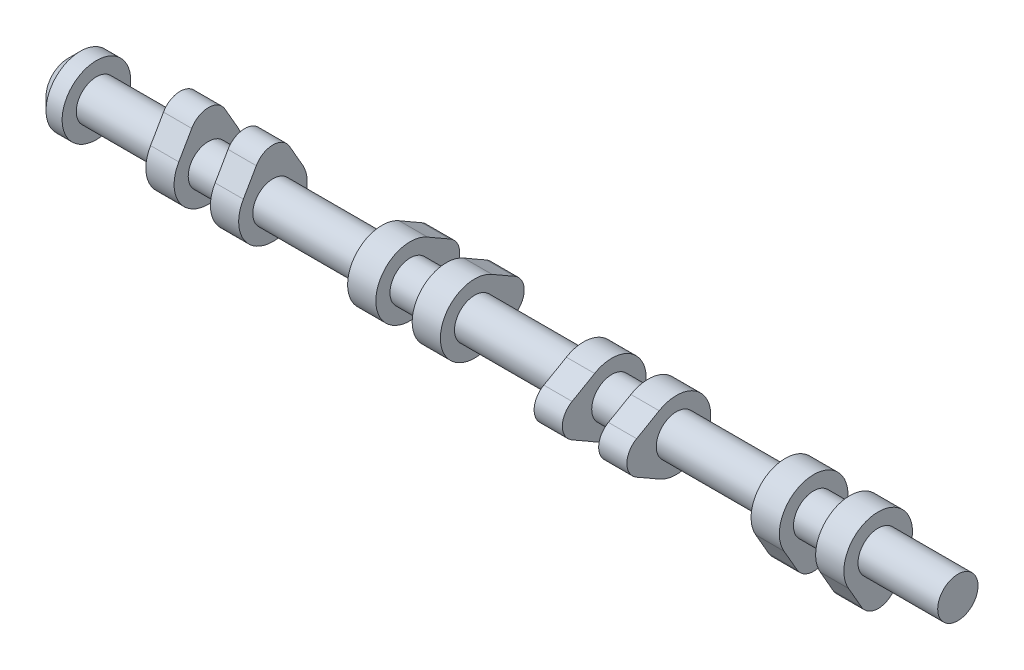
from build123d import *

# Parameters (mm, degrees)
BOSS_EXTRUDE2_DEPTH  = 14
FILLET3_R            = 9.5
FILLET5_R            = 1000
BOSS_EXTRUDE5_DEPTH  = 14
BOSS_EXTRUDE6_DEPTH  = 14
BOSS_EXTRUDE7_DEPTH  = 14
BOSS_EXTRUDE8_DEPTH  = 14
BOSS_EXTRUDE9_DEPTH  = 14
BOSS_EXTRUDE10_DEPTH = 14
BOSS_EXTRUDE11_DEPTH = 14
SKETCH1_6_W          = 16
SKETCH1_6_H          = 7
BOSS_EXTRUDE12_DEPTH = 16
FILLET6_R            = 1000
FILLET7_R            = 4
BOSS_EXTRUDE13_DEPTH = 16
BOSS_EXTRUDE14_DEPTH = 16
BOSS_EXTRUDE15_DEPTH = 16
FRONT_START          = 16
SKETCH22_R           = 17
FRONT_DEPTH          = 16
CHAMFER1_SIZE        = 6
SKETCH23_R           = 6
CUT_EXTRUDE1_DEPTH   = 40
CUT_EXTRUDE2_START   = -2
SKETCH24_R           = 17
SKETCH24_R_2         = 10
CUT_EXTRUDE2_DEPTH   = 2
CUT_EXTRUDE4_DEPTH   = 16
CUT_EXTRUDE5_DEPTH   = 16
CUT_EXTRUDE6_DEPTH   = 16
CUT_EXTRUDE7_DEPTH   = 16
SKETCH33_R           = 10
BOSS_EXTRUDE16_DEPTH = 16
SKETCH32_R           = 10
BOSS_EXTRUDE17_DEPTH = 16
SKETCH31_R           = 10
BOSS_EXTRUDE18_DEPTH = 16
SKETCH30_R           = 10
BOSS_EXTRUDE19_DEPTH = 16


# Some blends are built 0.0001 mm under size
with BuildPart() as part:
    # Sketch1 → Revolve1 (revolve)
    with BuildSketch(Plane.XY, mode=Mode.PRIVATE) as revolve1_sk:
        Polygon((10, 0), (0, 0), (0, -10), (425, -10), (425, 0), (415, 0), (385.5, 0), (378.5, 0), (371.5, 0), (370.5, 0), (354.5, 0), (353.5, 0), (346.5, 0), (339.5, 0), (285.5, 0), (278.5, 0), (271.5, 0), (270.5, 0), (254.5, 0), (253.5, 0), (246.5, 0), (239.5, 0), (185.5, 0), (178.5, 0), (171.5, 0), (170.5, 0), (154.5, 0), (153.5, 0), (146.5, 0), (139.5, 0), (85.5, 0), (78.5, 0), (71.5, 0), (70.5, 0), (54.5, 0), (53.5, 0), (46.5, 0), (39.5, 0), align=None)
    revolve(revolve1_sk.sketch.rotate(Axis((0, -10, 0), (1, 0, 0)), 90), axis=Axis((0, -10, 0), (1, 0, 0)))

    # Sketch1<5> → Revolve2 (revolve)
    with BuildSketch(Plane.XY, mode=Mode.PRIVATE) as revolve2_sk:
        Polygon((39.5, 7), (39.5, 0), (46.5, 0), (53.5, 0), (53.5, 7), align=None)
        Polygon((71.5, 7), (71.5, 0), (78.5, 0), (85.5, 0), (85.5, 7), align=None)
        Polygon((139.5, 7), (139.5, 0), (146.5, 0), (153.5, 0), (153.5, 7), align=None)
        Polygon((171.5, 7), (171.5, 0), (178.5, 0), (185.5, 0), (185.5, 7), align=None)
        Polygon((239.5, 7), (239.5, 0), (246.5, 0), (253.5, 0), (253.5, 7), align=None)
        Polygon((278.5, 0), (285.5, 0), (285.5, 7), (271.5, 7), (271.5, 0), align=None)
        Polygon((346.5, 0), (353.5, 0), (353.5, 7), (339.5, 7), (339.5, 0), align=None)
        Polygon((378.5, 0), (385.5, 0), (385.5, 7), (371.5, 7), (371.5, 0), align=None)
    revolve(revolve2_sk.sketch.rotate(Axis((0, -10, 0), (1, 0, 0)), 90), axis=Axis((0, -10, 0), (1, 0, 0)))

    # Sketch2 → Boss-Extrude2 (add)
    with BuildSketch(Plane.ZY.offset(-39.5)):
        with BuildLine():
            Line((0, 15), (0, 7))
            ThreePointArc((0, 7), (6.16158644, 5.844079416), (11.485254692, 2.533512064))
            Line((11.485254692, 2.533512064), (6, 15))
            Line((6, 15), (0, 15))
        make_face()
        with BuildLine():
            ThreePointArc((-11.485254692, 2.533512064), (-6.16158644, 5.844079416), (0, 7))
            Line((0, 7), (0, 15))
            Line((0, 15), (-6, 15))
            Line((-6, 15), (-11.485254692, 2.533512064))
        make_face()
    extrude(amount=-BOSS_EXTRUDE2_DEPTH)

    # Fillet3
    fillet3_edges = [part.edges().sort_by_distance(p)[0] for p in [
        (46.5, 15, 6),
    ]]
    fillet(fillet3_edges, radius=FILLET3_R)
    fillet3_2_edges = [part.edges().sort_by_distance(p)[0] for p in [
        (46.5, 15, -6),
    ]]
    fillet(fillet3_2_edges, radius=FILLET3_R - 0.0001)  # a hair under: the kernel refuses the full size

    # Fillet5
    fillet5_edges = [part.edges().sort_by_distance(p)[0] for p in [
        (46.5, 2.533512064, 11.485254692),
        (46.5, 2.533512064, -11.485254692),
    ]]
    fillet(fillet5_edges, radius=FILLET5_R)

    # Sketch10 → Boss-Extrude5 (add)
    with BuildSketch(Plane.ZY.offset(-71.5)):
        with BuildLine():
            ThreePointArc((-14.683259634, -1.432509905), (0, 7), (14.683259634, -1.432509905))
            ThreePointArc((14.683259634, -1.432509905), (11.456821538, 4.138186943), (8.266311974, 9.729538737))
            ThreePointArc((8.266311974, 9.729538737), (0, 14.547863146), (-8.266311974, 9.729538737))
            ThreePointArc((-8.266311974, 9.729538737), (-11.456821538, 4.138186943), (-14.683259634, -1.432509905))
        make_face()
    extrude(amount=-BOSS_EXTRUDE5_DEPTH)

    # Sketch11 → Boss-Extrude6 (add)
    with BuildSketch(Plane.ZY.offset(-239.5)):
        with BuildLine():
            ThreePointArc((8.567490095, 4.683259634), (14.741901703, -1.533812299), (17, -10))
            ThreePointArc((17, -10), (14.741901703, -18.466187701), (8.567490095, -24.683259634))
            ThreePointArc((8.567490095, -24.683259634), (14.138186943, -21.456821538), (19.729538737, -18.266311974))
            ThreePointArc((19.729538737, -18.266311974), (24.547863146, -10), (19.729538737, -1.733688026))
            ThreePointArc((19.729538737, -1.733688026), (14.138186943, 1.456821538), (8.567490095, 4.683259634))
        make_face()
    extrude(amount=-BOSS_EXTRUDE6_DEPTH)

    # Sketch12 → Boss-Extrude7 (add)
    with BuildSketch(Plane.ZY.offset(-271.5)):
        with BuildLine():
            ThreePointArc((19.729538737, -18.266311974), (24.547863146, -10), (19.729538737, -1.733688026))
            ThreePointArc((19.729538737, -1.733688026), (14.138186943, 1.456821538), (8.567490095, 4.683259634))
            ThreePointArc((8.567490095, 4.683259634), (-17, -10), (8.567490095, -24.683259634))
            ThreePointArc((8.567490095, -24.683259634), (14.138186943, -21.456821538), (19.729538737, -18.266311974))
        make_face()
    extrude(amount=-BOSS_EXTRUDE7_DEPTH)

    # Sketch14 → Boss-Extrude8 (add)
    with BuildSketch(Plane.ZY.offset(-371.5)):
        with BuildLine():
            ThreePointArc((-8.266311974, -29.729538737), (0, -34.547863146), (8.266311974, -29.729538737))
            ThreePointArc((8.266311974, -29.729538737), (11.456821538, -24.138186943), (14.683259634, -18.567490095))
            ThreePointArc((14.683259634, -18.567490095), (0, 7), (-14.683259634, -18.567490095))
            ThreePointArc((-14.683259634, -18.567490095), (-11.456821538, -24.138186943), (-8.266311974, -29.729538737))
        make_face()
    extrude(amount=-BOSS_EXTRUDE8_DEPTH)

    # Sketch13 → Boss-Extrude9 (add)
    with BuildSketch(Plane.ZY.offset(-339.5)):
        with BuildLine():
            ThreePointArc((-8.266311974, -29.729538737), (0, -34.547863146), (8.266311974, -29.729538737))
            ThreePointArc((8.266311974, -29.729538737), (11.456821538, -24.138186943), (14.683259634, -18.567490095))
            ThreePointArc((14.683259634, -18.567490095), (0, 7), (-14.683259634, -18.567490095))
            ThreePointArc((-14.683259634, -18.567490095), (-11.456821538, -24.138186943), (-8.266311974, -29.729538737))
        make_face()
    extrude(amount=-BOSS_EXTRUDE9_DEPTH)

    # Sketch15 → Boss-Extrude10 (add)
    with BuildSketch(Plane.ZY.offset(-139.5)):
        with BuildLine():
            ThreePointArc((-19.729538737, -1.733688026), (-24.547863146, -10), (-19.729538737, -18.266311974))
            ThreePointArc((-19.729538737, -18.266311974), (-14.138186943, -21.456821538), (-8.567490095, -24.683259634))
            ThreePointArc((-8.567490095, -24.683259634), (17, -10), (-8.567490095, 4.683259634))
            ThreePointArc((-8.567490095, 4.683259634), (-14.138186943, 1.456821538), (-19.729538737, -1.733688026))
        make_face()
    extrude(amount=-BOSS_EXTRUDE10_DEPTH)

    # Sketch16 → Boss-Extrude11 (add)
    with BuildSketch(Plane.ZY.offset(-171.5)):
        with BuildLine():
            ThreePointArc((-19.729538737, -1.733688026), (-24.547863146, -10), (-19.729538737, -18.266311974))
            ThreePointArc((-19.729538737, -18.266311974), (-14.138186943, -21.456821538), (-8.567490095, -24.683259634))
            ThreePointArc((-8.567490095, -24.683259634), (17, -10), (-8.567490095, 4.683259634))
            ThreePointArc((-8.567490095, 4.683259634), (-14.138186943, 1.456821538), (-19.729538737, -1.733688026))
        make_face()
    extrude(amount=-BOSS_EXTRUDE11_DEPTH)

    # Sketch1<6> → Revolve3 (revolve)
    with BuildSketch(Plane.XY, mode=Mode.PRIVATE) as revolve3_sk:
        with Locations((62.5, 3.5)):
            Rectangle(SKETCH1_6_W, SKETCH1_6_H)
        with Locations((162.5, 3.5)):
            Rectangle(SKETCH1_6_W, SKETCH1_6_H)
        with Locations((262.5, 3.5)):
            Rectangle(SKETCH1_6_W, SKETCH1_6_H)
        with Locations((362.5, 3.5)):
            Rectangle(SKETCH1_6_W, SKETCH1_6_H)
    revolve(revolve3_sk.sketch.rotate(Axis((0, -10, 0), (1, 0, 0)), 90), axis=Axis((0, -10, 0), (1, 0, 0)))

    # Sketch17 → Boss-Extrude12 (add)
    with BuildSketch(Plane.ZY.offset(-54.5)):
        Polygon((2, -30), (-2, -30), (-17, -10), (17, -10), align=None)
    extrude(amount=-BOSS_EXTRUDE12_DEPTH)

    # Fillet6
    # the kernel refuses this fillet: 1000 mm, written as the material it adds along each edge
    with BuildSketch(Plane(origin=(70.5, -26.32, -4.76), x_dir=(0, -0.8000000000000175, 0.5999999999999766), z_dir=(-1, 0, 0))) as fillet6_piece_1:
        with BuildLine():
            CenterArc((261.216037906, -966.513429337), FILLET6_R, 104.869364111, 0.609274669)
            ThreePointArc((-5.663055414, -2.783410323), (-2.701251625, -1.656761544), (0, 0))
            Line((0, 0), (4.6, 0))
        make_face()
    extrude(amount=16)
    with BuildSketch(Plane(origin=(70.5, -26.32, 4.76), x_dir=(0, -0.800000000000032, -0.5999999999999576), z_dir=(-1, 0, 0))) as fillet6_piece_2:
        with BuildLine():
            CenterArc((261.216037906, 966.513429337), FILLET6_R, 254.52136122, 0.609274669)
            ThreePointArc((-5.663055414, 2.783410323), (-2.701251625, 1.656761544), (0, 0))
            Line((0, 0), (4.6, 0))
        make_face()
    extrude(amount=16)

    # Fillet7
    fillet7_edges = [part.edges().sort_by_distance(p)[0] for p in [
        (62.5, -30, 2),
        (62.5, -30, -2),
    ]]
    fillet(fillet7_edges, radius=FILLET7_R)

    # Sketch21 → Boss-Extrude13 (add)
    with BuildSketch(Plane.ZY.offset(-354.5)):
        with BuildLine():
            Line((0.614051952, 10), (-0.614051952, 10))
            ThreePointArc((-0.614051952, 10), (-1.922312901, 9.780007049), (-3.086669756, 9.144226645))
            ThreePointArc((-3.086669756, 9.144226645), (-6.7290423, 6.293475446), (-10.384561507, 3.459601863))
            ThreePointArc((-10.384561507, 3.459601863), (0, -27), (10.384561507, 3.459601863))
            ThreePointArc((10.384561507, 3.459601863), (6.7290423, 6.293475446), (3.086669756, 9.144226645))
            ThreePointArc((3.086669756, 9.144226645), (1.922312901, 9.780007049), (0.614051952, 10))
        make_face()
    extrude(amount=-BOSS_EXTRUDE13_DEPTH)

    # Sketch20 → Boss-Extrude14 (add)
    with BuildSketch(Plane.ZY.offset(-254.5)):
        with BuildLine():
            Line((-20, -9.385948048), (-20, -10.614051952))
            ThreePointArc((-20, -10.614051952), (-19.780007049, -11.922312901), (-19.144226645, -13.086669756))
            ThreePointArc((-19.144226645, -13.086669756), (-16.293475446, -16.7290423), (-13.459601863, -20.384561507))
            ThreePointArc((-13.459601863, -20.384561507), (17, -10), (-13.459601863, 0.384561507))
            ThreePointArc((-13.459601863, 0.384561507), (-16.293475446, -3.2709577), (-19.144226645, -6.913330244))
            ThreePointArc((-19.144226645, -6.913330244), (-19.780007049, -8.077687099), (-20, -9.385948048))
        make_face()
    extrude(amount=-BOSS_EXTRUDE14_DEPTH)

    # Sketch19 → Boss-Extrude15 (add)
    with BuildSketch(Plane.ZY.offset(-154.5)):
        with BuildLine():
            Line((20, -10.614051952), (20, -9.385948048))
            ThreePointArc((20, -9.385948048), (19.780007049, -8.077687099), (19.144226645, -6.913330244))
            ThreePointArc((19.144226645, -6.913330244), (16.293475446, -3.2709577), (13.459601863, 0.384561507))
            ThreePointArc((13.459601863, 0.384561507), (-17, -10), (13.459601863, -20.384561507))
            ThreePointArc((13.459601863, -20.384561507), (16.293475446, -16.7290423), (19.144226645, -13.086669756))
            ThreePointArc((19.144226645, -13.086669756), (19.780007049, -11.922312901), (20, -10.614051952))
        make_face()
    extrude(amount=-BOSS_EXTRUDE15_DEPTH)

    # Sketch22 → Front (add)
    with BuildSketch(Plane.ZY.offset(FRONT_START)):
        with Locations((0, -10)):
            Circle(SKETCH22_R)
    extrude(amount=-FRONT_DEPTH)

    # Chamfer1
    chamfer1_edges = [part.edges().sort_by_distance(p)[0] for p in [
        (-16, -10, -17),
    ]]
    chamfer(chamfer1_edges, length=CHAMFER1_SIZE)

    # Sketch23 → Cut-Extrude1 (cut)
    with BuildSketch(Plane.ZY.offset(16)):
        with Locations((0, -10)):
            Circle(SKETCH23_R)
    extrude(amount=-CUT_EXTRUDE1_DEPTH, mode=Mode.SUBTRACT)

    # Sketch24 → Cut-Extrude2 (cut)
    with BuildSketch(Plane(origin=(0, 0, 0), x_dir=(0, 0, -1), z_dir=(1, 0, 0)).offset(CUT_EXTRUDE2_START)):
        with Locations((0, -10)):
            Circle(SKETCH24_R)
        with Locations(Location((0, -10, 0), (0, 0, 180))):
            Circle(SKETCH24_R_2, mode=Mode.SUBTRACT)
    extrude(amount=CUT_EXTRUDE2_DEPTH, mode=Mode.SUBTRACT)

    # Sketch28 → Cut-Extrude4 (cut)
    with BuildSketch(Plane.ZY.offset(-354.5)):
        with BuildLine():
            Line((0.614051952, 10), (-0.614051952, 10))
            ThreePointArc((-0.614051952, 10), (-1.922312901, 9.780007049), (-3.086669756, 9.144226645))
            ThreePointArc((-3.086669756, 9.144226645), (-6.7290423, 6.293475446), (-10.384561507, 3.459601863))
            ThreePointArc((-10.384561507, 3.459601863), (0, -27), (10.384561507, 3.459601863))
            ThreePointArc((10.384561507, 3.459601863), (6.7290423, 6.293475446), (3.086669756, 9.144226645))
            ThreePointArc((3.086669756, 9.144226645), (1.922312901, 9.780007049), (0.614051952, 10))
        make_face()
    extrude(amount=-CUT_EXTRUDE4_DEPTH, mode=Mode.SUBTRACT)


with BuildPart() as cut_extrude4_piece_1:
    # of the separate pieces the step leaves, piece 1, a body of its own (cut_extrude4_pieces)
    add(part.part.solids().sort_by_distance((-10, -10, 17))[0])

    # Sketch27 → Cut-Extrude5 (cut)
    with BuildSketch(Plane.ZY.offset(-254.5)):
        with BuildLine():
            Line((-20, -9.385948048), (-20, -10.614051952))
            ThreePointArc((-20, -10.614051952), (-19.780007049, -11.922312901), (-19.144226645, -13.086669756))
            ThreePointArc((-19.144226645, -13.086669756), (-16.293475446, -16.7290423), (-13.459601863, -20.384561507))
            ThreePointArc((-13.459601863, -20.384561507), (17, -10), (-13.459601863, 0.384561507))
            ThreePointArc((-13.459601863, 0.384561507), (-16.293475446, -3.2709577), (-19.144226645, -6.913330244))
            ThreePointArc((-19.144226645, -6.913330244), (-19.780007049, -8.077687099), (-20, -9.385948048))
        make_face()
    extrude(amount=-CUT_EXTRUDE5_DEPTH, mode=Mode.SUBTRACT)


with BuildPart() as cut_extrude4_piece_2:
    # of the separate pieces the step leaves, piece 2, a body of its own (cut_extrude4_pieces)
    add(part.part.solids().sort_by_distance((370.5, -10, 10))[0])



with BuildPart() as cut_extrude5_piece_1:
    # of the separate pieces the step leaves, piece 1, a body of its own (cut_extrude5_pieces)
    add(cut_extrude4_piece_1.part.solids().sort_by_distance((-10, -10, 17))[0])

    # Sketch26 → Cut-Extrude6 (cut)
    with BuildSketch(Plane.ZY.offset(-154.5)):
        with BuildLine():
            Line((20, -10.614051952), (20, -9.385948048))
            ThreePointArc((20, -9.385948048), (19.780007049, -8.077687099), (19.144226645, -6.913330244))
            ThreePointArc((19.144226645, -6.913330244), (16.293475446, -3.2709577), (13.459601863, 0.384561507))
            ThreePointArc((13.459601863, 0.384561507), (-17, -10), (13.459601863, -20.384561507))
            ThreePointArc((13.459601863, -20.384561507), (16.293475446, -16.7290423), (19.144226645, -13.086669756))
            ThreePointArc((19.144226645, -13.086669756), (19.780007049, -11.922312901), (20, -10.614051952))
        make_face()
    extrude(amount=-CUT_EXTRUDE6_DEPTH, mode=Mode.SUBTRACT)


with BuildPart() as cut_extrude5_piece_2:
    # of the separate pieces the step leaves, piece 2, a body of its own (cut_extrude5_pieces)
    add(cut_extrude4_piece_1.part.solids().sort_by_distance((270.5, -10, 10))[0])


with BuildPart() as cut_extrude6_piece_1:
    # of the separate pieces the step leaves, piece 1, a body of its own (cut_extrude6_pieces)
    add(cut_extrude5_piece_1.part.solids().sort_by_distance((-10, -10, 17))[0])

    # Sketch25 → Cut-Extrude7 (cut)
    with BuildSketch(Plane.ZY.offset(-54.5)):
        with BuildLine():
            Line((-0.614051952, -30), (0.614051952, -30))
            ThreePointArc((0.614051952, -30), (1.922312901, -29.780007049), (3.086669756, -29.144226645))
            ThreePointArc((3.086669756, -29.144226645), (6.7290423, -26.293475446), (10.384561507, -23.459601863))
            ThreePointArc((10.384561507, -23.459601863), (0, 7), (-10.384561507, -23.459601863))
            ThreePointArc((-10.384561507, -23.459601863), (-6.7290423, -26.293475446), (-3.086669756, -29.144226645))
            ThreePointArc((-3.086669756, -29.144226645), (-1.922312901, -29.780007049), (-0.614051952, -30))
        make_face()
    extrude(amount=-CUT_EXTRUDE7_DEPTH, mode=Mode.SUBTRACT)


with BuildPart() as cut_extrude6_piece_2:
    # of the separate pieces the step leaves, piece 2, a body of its own (cut_extrude6_pieces)
    add(cut_extrude5_piece_1.part.solids().sort_by_distance((170.5, -10, 10))[0])


with BuildPart() as cut_extrude7_piece_1:
    # of the separate pieces the step leaves, piece 1, a body of its own (cut_extrude7_pieces)
    add(cut_extrude6_piece_1.part.solids().sort_by_distance((71.5, -10, 10))[0])


with BuildPart() as cut_extrude7_piece_2:
    # of the separate pieces the step leaves, piece 2, a body of its own (cut_extrude7_pieces)
    add(cut_extrude6_piece_1.part.solids().sort_by_distance((-10, -10, 17))[0])


with BuildPart() as cut_extrude4_piece_2_1:
    add(cut_extrude4_piece_2.part)

    add(cut_extrude5_piece_2.part)  # Boss-Extrude16 merges Cut-Extrude5 piece 2
    # Sketch33 → Boss-Extrude16 (add)
    with BuildSketch(Plane(origin=(354.5, 0, 0), x_dir=(0, 0, -1), z_dir=(1, 0, 0))):
        with Locations(Location((0, -10, 0), (0, 0, 180))):
            Circle(SKETCH33_R)
    extrude(amount=BOSS_EXTRUDE16_DEPTH)


    add(cut_extrude6_piece_2.part)  # Boss-Extrude17 merges Cut-Extrude6 piece 2
    # Sketch32 → Boss-Extrude17 (add)
    with BuildSketch(Plane(origin=(254.5, 0, 0), x_dir=(0, 0, -1), z_dir=(1, 0, 0))):
        with Locations(Location((0, -10, 0), (0, 0, 180))):
            Circle(SKETCH32_R)
    extrude(amount=BOSS_EXTRUDE17_DEPTH)


    add(cut_extrude7_piece_1.part)  # Boss-Extrude18 merges Cut-Extrude7 piece 1
    # Sketch31 → Boss-Extrude18 (add)
    with BuildSketch(Plane(origin=(154.5, 0, 0), x_dir=(0, 0, -1), z_dir=(1, 0, 0))):
        with Locations(Location((0, -10, 0), (0, 0, 180))):
            Circle(SKETCH31_R)
    extrude(amount=BOSS_EXTRUDE18_DEPTH)


    add(cut_extrude7_piece_2.part)  # Boss-Extrude19 merges Cut-Extrude7 piece 2
    # Sketch30 → Boss-Extrude19 (add)
    with BuildSketch(Plane(origin=(54.5, 0, 0), x_dir=(0, 0, -1), z_dir=(1, 0, 0))):
        with Locations(Location((0, -10, 0), (0, 0, 180))):
            Circle(SKETCH30_R)
    extrude(amount=BOSS_EXTRUDE19_DEPTH)


solid = cut_extrude4_piece_2_1.part
